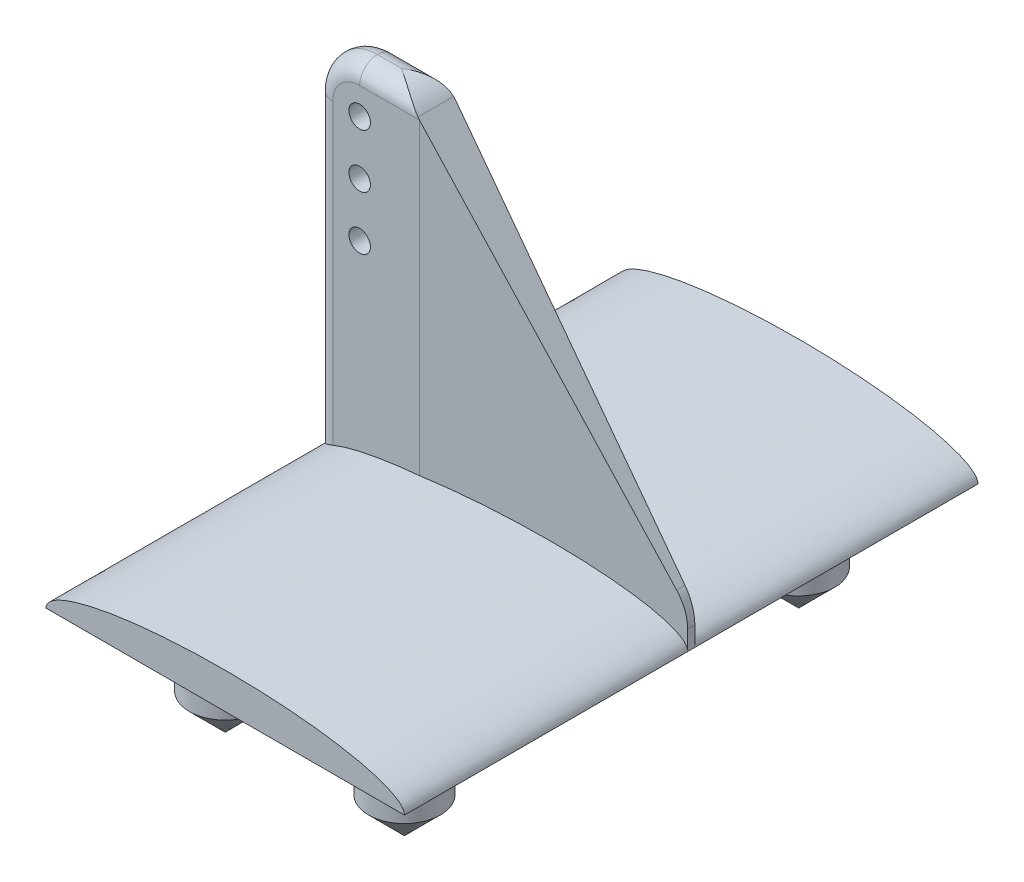
from build123d import *

# Parameters (mm, degrees)
SKETCH1_R                = 0.6
SKETCH1_W                = 20
SKETCH1_H                = 2
BOSS_EXTRUDE1_DEPTH      = 2
FILLET1_R                = 2.5
FILLET2_R                = 1
CUT_EXTRUDE1_DEPTH       = 29.354893835
CUT_EXTRUDE1_DEPTH_BACK  = 29.354893835
BOSS_EXTRUDE2_DEPTH      = 15
BOSS_EXTRUDE2_DEPTH_BACK = 17
SKETCH5_R                = 2
BOSS_EXTRUDE3_DEPTH      = 6
CHAMFER1_SIZE            = 2


with BuildPart() as part:
    # Sketch1 → Boss-Extrude1 (new body)
    # profile 1 of 2: a face of its own
    with BuildSketch(Plane.XY):
        Polygon((20, 0), (0, 0), (0, 18), (5, 18), align=None)
        with Locations((2.5, 9.5)):
            Circle(SKETCH1_R, mode=Mode.SUBTRACT)
        with Locations((2.5, 12.5)):
            Circle(SKETCH1_R, mode=Mode.SUBTRACT)
        with Locations((2.5, 15.5)):
            Circle(SKETCH1_R, mode=Mode.SUBTRACT)
    # profile 2 of 2: a face of its own
    with BuildSketch(Plane.XY):
        with Locations((10, -1)):
            Rectangle(SKETCH1_W, SKETCH1_H)
    extrude(amount=BOSS_EXTRUDE1_DEPTH)

    # Fillet1
    fillet1_edges = [part.edges().sort_by_distance(p)[0] for p in [
        (0, 18, 1),
        (5, 18, 1),
        (20, 0, 1),
    ]]
    fillet(fillet1_edges, radius=FILLET1_R)

    # Fillet2
    # the kernel refuses this fillet: 1 mm, written as the material it takes off along each edge
    with BuildSketch(Plane(origin=(0, -4.5, 2), x_dir=(0, 0, -1), z_dir=(0, 1, 0)), Plane(origin=(0, 15.5, 0), x_dir=(0, 0, 1), z_dir=(0, -1, 0))) as fillet2_piece_1:
        with BuildLine():
            CenterArc((FILLET2_R, -FILLET2_R), FILLET2_R, 90, 90)
            Line((0, -FILLET2_R), (0, 0))
            Line((0, 0), (FILLET2_R, 0))
        make_face()
    extrude(amount=20, mode=Mode.SUBTRACT)
    with BuildSketch(Plane(origin=(2.5, 18, 2), x_dir=(0, -1, 0), z_dir=(1, 0, 0))) as fillet2_piece_2:
        with BuildLine():
            CenterArc((FILLET2_R, FILLET2_R), FILLET2_R, 180, 90)
            Line((0, FILLET2_R), (0, 0))
            Line((0, 0), (FILLET2_R, 0))
        make_face()
    extrude(amount=3.829062635, mode=Mode.SUBTRACT)
    with BuildSketch(Plane(origin=(2.5, 18, 0), x_dir=(0, -1, 0), z_dir=(1, 0, 0))) as fillet2_piece_3:
        with BuildLine():
            CenterArc((FILLET2_R, -FILLET2_R), FILLET2_R, 90, 90)
            Line((0, -FILLET2_R), (0, 0))
            Line((0, 0), (FILLET2_R, 0))
        make_face()
    extrude(amount=3.829062635, mode=Mode.SUBTRACT)
    with BuildSketch(Plane(origin=(2.5, 15.5, 2), x_dir=(-1, 0, 0), z_dir=(0, -1, 0))) as fillet2_piece_4:
        with BuildLine():
            CenterArc((2.5 - FILLET2_R, FILLET2_R), FILLET2_R, 270, 90)
            Line((2.5 - FILLET2_R, 0), (2.5, 0))
            Line((2.5, 0), (2.5, FILLET2_R))
        make_face()
    revolve(axis=Axis((2.5, 15.5, 2), (0, 0, -1)), revolution_arc=90, mode=Mode.SUBTRACT)
    with BuildSketch(Plane(origin=(2.5, 15.5, 0), x_dir=(-1, 0, 0), z_dir=(0, -1, 0))) as fillet2_piece_5:
        with BuildLine():
            CenterArc((2.5 - FILLET2_R, -FILLET2_R), FILLET2_R, 0, 90)
            Line((2.5, -FILLET2_R), (2.5, 0))
            Line((2.5, 0), (2.5 - FILLET2_R, 0))
        make_face()
    revolve(axis=Axis((2.5, 15.5, 0), (0, 0, -1)), revolution_arc=90, mode=Mode.SUBTRACT)

    # Sketch4 → Cut-Extrude1 (cut, two sides: drawn at the far end of the back side and taken through both)
    with BuildSketch(Plane.XZ.offset(2).offset(-CUT_EXTRUDE1_DEPTH_BACK)):
        Polygon((20, 2), (5.833333333, 2), (20, 1.2), align=None)
        Polygon((20, 0), (20, 0.8), (5.833333333, 0), align=None)
    extrude(amount=CUT_EXTRUDE1_DEPTH + CUT_EXTRUDE1_DEPTH_BACK, mode=Mode.SUBTRACT)

    # Sketch3 → Boss-Extrude2 (add, two sides: drawn at the far end of the back side and taken through both)
    with BuildSketch(Plane(origin=(0, 0, 0), x_dir=(-1, 0, 0), z_dir=(0, 0, -1)).offset(-BOSS_EXTRUDE2_DEPTH_BACK)):
        with BuildLine():
            Line((-20, -2), (-5.833333333, -2))
            Line((-5.833333333, -2), (-5.833333333, -0.181881314))
            add(Edge.make_bspline(
                [(-5.833333333, -0.181881314), (-7.817424229, 0), (-10, 0)],
                knots=[4.267741054, 4.267741054, 4.267741054, 4.71238898, 4.71238898, 4.71238898], degree=2, weights=[0.881119273, 0.91709023, 1]))
            add(Edge.make_bspline(
                [(-10, 0), (-20, 0), (-20, -2)],
                knots=[4.71238898, 4.71238898, 4.71238898, 6.283185307, 6.283185307, 6.283185307], degree=2, weights=[1, 0.707106781, 1]))
        make_face()
        with BuildLine():
            Line((-5.833333333, -2), (-1, -2))
            Line((-1, -2), (-1, -1.128220211))
            add(Edge.make_bspline(
                [(-1, -1.128220211), (-2.566454032, -0.481355649), (-5.833333333, -0.181881314)],
                knots=[3.606999967, 3.606999967, 3.606999967, 4.267741054, 4.267741054, 4.267741054], degree=2, weights=[0.877862815, 0.827666894, 0.881119273]))
            Line((-5.833333333, -0.181881314), (-5.833333333, -2))
        make_face()
        with BuildLine():
            Line((-1, -1.128220211), (-1, -2))
            Line((-1, -2), (0, -2))
            add(Edge.make_bspline(
                [(0, -2), (0, -1.541168532), (-1, -1.128220211)],
                knots=[3.141592654, 3.141592654, 3.141592654, 3.606999967, 3.606999967, 3.606999967], degree=2, weights=[1, 0.913219401, 0.877862815]))
        make_face()
    extrude(amount=BOSS_EXTRUDE2_DEPTH + BOSS_EXTRUDE2_DEPTH_BACK)

    # Sketch5 → Boss-Extrude3 (add)
    with BuildSketch(Plane.XZ.offset(2)):
        with Locations(Location((5, 12, 0), (0, 0, 90))):
            Circle(SKETCH5_R)
        with Locations(Location((15, 12, 0), (0, 0, 90))):
            Circle(SKETCH5_R)
        with Locations(Location((15, -10, 0), (0, 0, 90))):
            Circle(SKETCH5_R)
        with Locations(Location((5, -10, 0), (0, 0, 90))):
            Circle(SKETCH5_R)
    extrude(amount=BOSS_EXTRUDE3_DEPTH)

    # Chamfer1
    chamfer1_edges = [part.edges().sort_by_distance(p)[0] for p in [
        (5, -8, 10),
        (15, -8, 10),
        (15, -8, -12),
        (5, -8, -12),
    ]]
    chamfer(chamfer1_edges, length=CHAMFER1_SIZE)


solid = part.part
